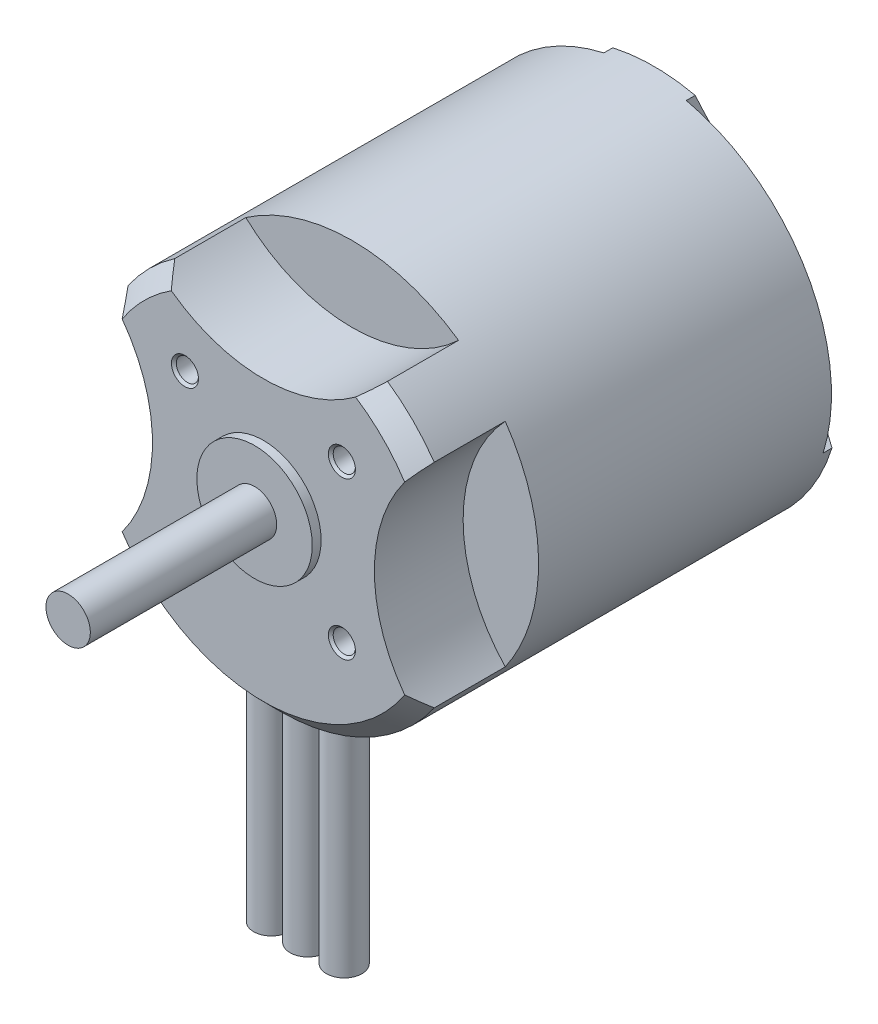
from build123d import *

# Parameters (mm, degrees)
SKETCH1_R                       = 21
BOSS_EXTRUDE1_DEPTH             = 48
SKETCH2_R                       = 2.5
BOSS_EXTRUDE2_DEPTH             = 22
M3X0_5_TAPPED_HOLE1_D           = 2.5
M3X0_5_TAPPED_HOLE1_DEPTH       = 7.5
M3X0_5_TAPPED_HOLE1_CSINK_D     = 3.05
M3X0_5_TAPPED_HOLE1_CSINK_ANGLE = 90
M3X0_5_TAPPED_HOLE1_TIP         = 0.751075774
M3X0_5_TAPPED_HOLE2_D           = 2.5
M3X0_5_TAPPED_HOLE2_DEPTH       = 7.5
M3X0_5_TAPPED_HOLE2_CSINK_D     = 3.05
M3X0_5_TAPPED_HOLE2_CSINK_ANGLE = 90
M3X0_5_TAPPED_HOLE2_TIP         = 0.751075774
CHAMFER2_SIZE                   = 8.5
CHAMFER2_SIZE2                  = 4
CUT_EXTRUDE1_DEPTH              = 5
SKETCH10_R                      = 5.5
BOSS_EXTRUDE3_DEPTH             = 2
CHAMFER1_SIZE                   = 1
CHAMFER3_SIZE                   = 2
SKETCH11_R                      = 17.5
CUT_EXTRUDE2_DEPTH              = 10
SKETCH12_R                      = 2
BOSS_EXTRUDE6_DEPTH             = 45
SKETCH13_R                      = 6.5
BOSS_EXTRUDE7_DEPTH             = 1


with BuildPart() as part:
    # Sketch1 → Boss-Extrude1 (new body)
    with BuildSketch(Plane.XY):
        Circle(SKETCH1_R)
    extrude(amount=-BOSS_EXTRUDE1_DEPTH)

    # Sketch2 → Boss-Extrude2 (add)
    with BuildSketch(Plane.XY):
        Circle(SKETCH2_R)
    extrude(amount=BOSS_EXTRUDE2_DEPTH)

    # M3x0.5 Tapped Hole1
    with Locations(Plane.XY):
        with Locations((-8.838834765, -8.838834765), (-8.838834765, 8.838834765), (8.838834765, 8.838834765), (8.838834765, -8.838834765)):
            CounterSinkHole(M3X0_5_TAPPED_HOLE1_D / 2, M3X0_5_TAPPED_HOLE1_CSINK_D / 2, depth=M3X0_5_TAPPED_HOLE1_DEPTH, counter_sink_angle=M3X0_5_TAPPED_HOLE1_CSINK_ANGLE)
            with Locations((0, 0, -(M3X0_5_TAPPED_HOLE1_DEPTH + M3X0_5_TAPPED_HOLE1_TIP / 2))):  # 118° drill point
                Cone(0, M3X0_5_TAPPED_HOLE1_D / 2, M3X0_5_TAPPED_HOLE1_TIP, mode=Mode.SUBTRACT)

    # M3x0.5 Tapped Hole2
    with Locations(Plane(origin=(0, 0, -48), x_dir=(-1, 0, 0), z_dir=(0, 0, -1))):
        with Locations((0, 7.505553499), (6.5, -3.75277675), (-6.5, -3.75277675)):
            CounterSinkHole(M3X0_5_TAPPED_HOLE2_D / 2, M3X0_5_TAPPED_HOLE2_CSINK_D / 2, depth=M3X0_5_TAPPED_HOLE2_DEPTH, counter_sink_angle=M3X0_5_TAPPED_HOLE2_CSINK_ANGLE)
            with Locations((0, 0, -(M3X0_5_TAPPED_HOLE2_DEPTH + M3X0_5_TAPPED_HOLE2_TIP / 2))):  # 118° drill point
                Cone(0, M3X0_5_TAPPED_HOLE2_D / 2, M3X0_5_TAPPED_HOLE2_TIP, mode=Mode.SUBTRACT)

    # Chamfer2
    chamfer2_edges = [part.edges().sort_by_distance(p)[0] for p in [
        (-21, 0, -48),
    ]]
    chamfer2_side = [part.faces().sort_by_distance(p)[0] for p in [
        (0, 0, -48),
    ]]
    chamfer(chamfer2_edges, length=CHAMFER2_SIZE, length2=CHAMFER2_SIZE2, reference=chamfer2_side[0])

    # Sketch9 → Cut-Extrude1 (cut)
    with BuildSketch(Plane(origin=(0, 0, -48), x_dir=(-1, 0, 0), z_dir=(0, 0, -1))):
        with BuildLine():
            ThreePointArc((-10.272558828, 2.502049044), (-7.361215932, 4.25), (-7.303117447, 7.645272385))
            ThreePointArc((-7.303117447, 7.645272385), (-60.621778265, 35), (-10.272558828, 2.502049044))
        make_face()
        with BuildLine():
            ThreePointArc((7.303117447, 7.645272385), (7.361215932, 4.25), (10.272558828, 2.502049044))
            ThreePointArc((10.272558828, 2.502049044), (60.621778265, 35), (7.303117447, 7.645272385))
        make_face()
        with BuildLine():
            ThreePointArc((2.96944138, -10.147321429), (0, -8.5), (-2.96944138, -10.147321429))
            ThreePointArc((-2.96944138, -10.147321429), (0, -70), (2.96944138, -10.147321429))
        make_face()
    extrude(amount=-CUT_EXTRUDE1_DEPTH, mode=Mode.SUBTRACT)

    # Sketch10 → Boss-Extrude3 (add)
    with BuildSketch(Plane(origin=(0, 0, -48), x_dir=(-1, 0, 0), z_dir=(0, 0, -1))):
        Circle(SKETCH10_R)
    extrude(amount=BOSS_EXTRUDE3_DEPTH)

    # Chamfer1
    chamfer1_edges = [part.edges().sort_by_distance(p)[0] for p in [
        (5.5, 0, -50),
    ]]
    chamfer(chamfer1_edges, length=CHAMFER1_SIZE)

    # Chamfer3
    chamfer3_edges = [part.edges().sort_by_distance(p)[0] for p in [
        (-21, 0, 0),
    ]]
    chamfer(chamfer3_edges, length=CHAMFER3_SIZE)

    # Sketch11 → Cut-Extrude2 (cut)
    with BuildSketch(Plane.XY):
        with Locations((-30, 0)):
            Circle(SKETCH11_R)
        with Locations((0, 30)):
            Circle(SKETCH11_R)
        with Locations((30, 0)):
            Circle(SKETCH11_R)
    extrude(amount=-CUT_EXTRUDE2_DEPTH, mode=Mode.SUBTRACT)

    # Sketch12 → Boss-Extrude6 (add)
    with BuildSketch(Plane(origin=(0, 0, 0), x_dir=(1, 0, 0), z_dir=(0, 1, 0))):
        with Locations((0, 5)):
            Circle(SKETCH12_R)
        with Locations((-4.1, 5)):
            Circle(SKETCH12_R)
        with Locations((4.1, 5)):
            Circle(SKETCH12_R)
    extrude(amount=-BOSS_EXTRUDE6_DEPTH)

    # Sketch13 → Boss-Extrude7 (add)
    with BuildSketch(Plane.XY):
        Circle(SKETCH13_R)
    extrude(amount=BOSS_EXTRUDE7_DEPTH)


solid = part.part
